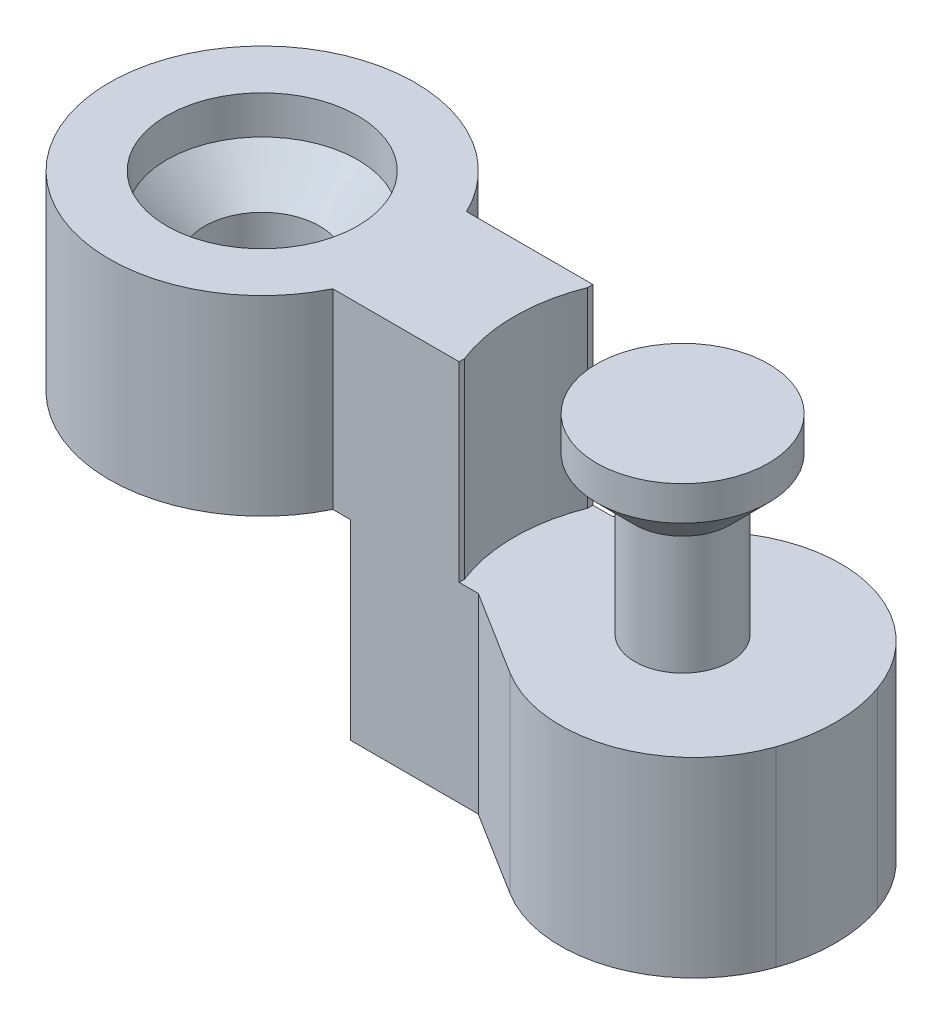
from build123d import *

# Parameters (mm, degrees)
SKETCH3_R               = 8
BOSS_EXTRUDE1_DEPTH     = 10
BOSS_EXTRUDE2_DEPTH     = 10
CUT_EXTRUDE1_DEPTH      = 34.648922717
CUT_EXTRUDE1_DEPTH_BACK = 34.648922717
SKETCH7_W               = 15.693747285
SKETCH7_H               = 10.5
SKETCH7_W_2             = 16.693747285
SKETCH13_R              = 8.806252715
SKETCH13_R_2            = 4.5
CUT_EXTRUDE2_DEPTH      = 10
FILLET1_R               = 7
CUT_EXTRUDE3_DEPTH      = 10


# Read off the part's stored shape, not the designer's step: Revolve1
with BuildPart() as part:
    # Sketch3 → Boss-Extrude1 (new, symmetric)
    with BuildSketch(Plane(origin=(0, 0, 0), x_dir=(1, 0, 0), z_dir=(0, 1, 0))):
        with Locations(Location((0, 0, 0), (0, 0, 270))):
            Circle(SKETCH3_R)
    extrude(amount=BOSS_EXTRUDE1_DEPTH, both=True)

    # Sketch6 → Boss-Extrude2 (add, symmetric)
    with BuildSketch(Plane(origin=(0, 0, 0), x_dir=(1, 0, 0), z_dir=(0, 1, 0))):
        with BuildLine():
            Line((7.193747285, -3.5), (14.806252715, -3.5))
            Line((14.806252715, -3.5), (22, -8))
            ThreePointArc((22, -8), (30, 0), (22, 8))
            Line((22, 8), (14.806252715, 3.5))
            Line((14.806252715, 3.5), (7.193747285, 3.5))
            ThreePointArc((7.193747285, 3.5), (8, 0), (7.193747285, -3.5))
        make_face()
    extrude(amount=BOSS_EXTRUDE2_DEPTH, both=True)

    # Sketch7 → Cut-Extrude1 (cut, two sides: drawn at the far end of the back side and taken through both)
    with BuildSketch(Plane.XY.offset(3.5).offset(-CUT_EXTRUDE1_DEPTH_BACK)):
        with Locations((-0.653126357, -5.25)):
            Rectangle(SKETCH7_W, SKETCH7_H)
        with Locations((22.153126358, 5.25)):
            Rectangle(SKETCH7_W_2, SKETCH7_H)
    extrude(amount=CUT_EXTRUDE1_DEPTH + CUT_EXTRUDE1_DEPTH_BACK, mode=Mode.SUBTRACT)

    # Sketch8 → Cut-Revolve2 (revolve, cut)
    with BuildSketch(Plane.XY, mode=Mode.PRIVATE) as cut_revolve2_sk:
        Polygon((0, 10), (0, 0), (3, 0), (3, 6), (5, 8), (5, 10), align=None)
    revolve(cut_revolve2_sk.sketch.rotate(Axis((0, 11.592954006, 0), (0, -1, 0)), 90), axis=Axis((0, 11.592954006, 0), (0, -1, 0)), mode=Mode.SUBTRACT)

    # Revolve1 outline → Revolve1 (revolve)
    with BuildSketch(Plane(origin=(22, 0, 0), x_dir=(1, 0, 0), z_dir=(0, 0, 1))):
        Polygon((0, 10), (0, 0), (2.5, 0), (2.5, 6.207106781), (4.5, 8.207106781), (4.5, 10), align=None)
    revolve(axis=Axis((22, 0, 0), (0, 1, 0)))

    # Sketch13 → Cut-Extrude2 (cut)
    with BuildSketch(Plane(origin=(0, 10, 0), x_dir=(1, 0, 0), z_dir=(0, 1, 0))):
        with Locations((22, 0)):
            Circle(SKETCH13_R)
        with Locations(Location((22, 0, 0), (0, 0, 270))):
            Circle(SKETCH13_R_2, mode=Mode.SUBTRACT)
    extrude(amount=-CUT_EXTRUDE2_DEPTH, mode=Mode.SUBTRACT)

    # Fillet1
    fillet1_edges = [part.edges().sort_by_distance(p)[0] for p in [
        (22, -5, -8),
        (22, -5, 8),
    ]]
    fillet(fillet1_edges, radius=FILLET1_R)

    # Sketch14 → Cut-Extrude3 (cut)
    with BuildSketch(Plane.XZ.offset(10)):
        with BuildLine():
            Line((8.693747285, -3.5), (8.693747285, 0.353821083))
            ThreePointArc((8.693747285, 0.353821083), (6.057708316, 6.717782114), (-0.306252715, 9.353821083))
            Line((-0.306252715, 9.353821083), (-1.238376204, 9.353821083))
            ThreePointArc((-1.238376204, 9.353821083), (-36.061646902, -27.818232152), (8.693747285, -3.5))
        make_face()
    extrude(amount=-CUT_EXTRUDE3_DEPTH, mode=Mode.SUBTRACT)


solid = part.part
